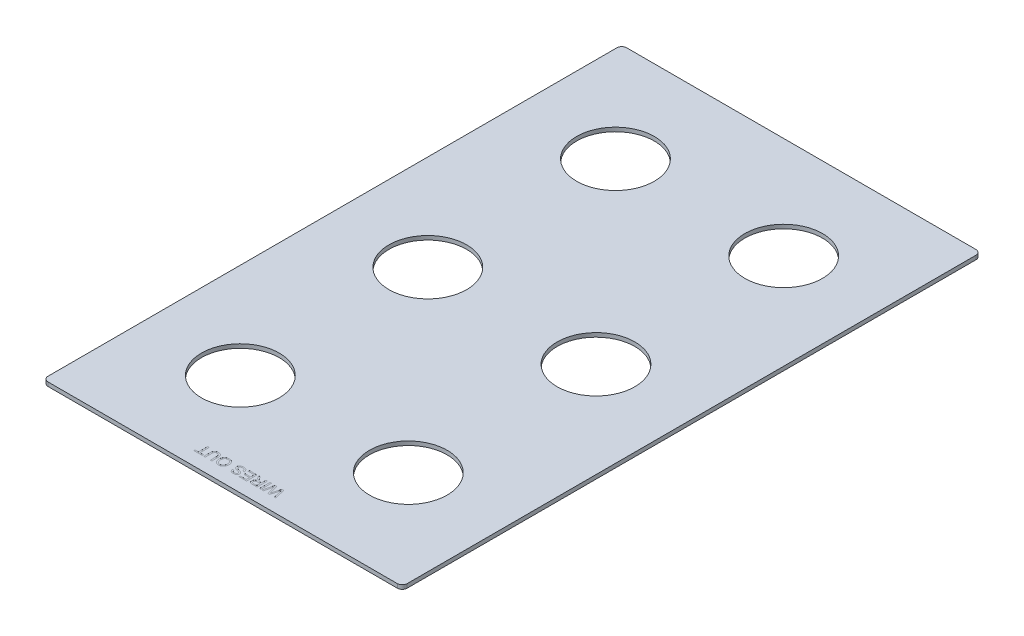
from build123d import *

# Parameters (mm, degrees)
SKETCH1_R           = 24.727
BOSS_EXTRUDE1_DEPTH = 2.54
SKETCH2_W           = 0.941716851
SKETCH2_H           = 6.677628581
CUT_EXTRUDE2_DEPTH  = 0.0254


with BuildPart() as part:
    # Sketch1 → Boss-Extrude1 (new body)
    with BuildSketch(Plane(origin=(0, 0, 0), x_dir=(1, 0, 0), z_dir=(0, 1, 0))):
        with BuildLine():
            Line((-111.125, 184.15), (111.125, 184.15))
            ThreePointArc((111.125, 184.15), (113.37006403, 183.22006403), (114.3, 180.975))
            Line((114.3, 180.975), (114.3, -180.975))
            ThreePointArc((114.3, -180.975), (113.37006403, -183.22006403), (111.125, -184.15))
            Line((111.125, -184.15), (-111.125, -184.15))
            ThreePointArc((-111.125, -184.15), (-113.37006403, -183.22006403), (-114.3, -180.975))
            Line((-114.3, -180.975), (-114.3, 180.975))
            ThreePointArc((-114.3, 180.975), (-113.37006403, 183.22006403), (-111.125, 184.15))
        make_face()
        with Locations((53.5178, -119.508581684)):
            Circle(SKETCH1_R, mode=Mode.SUBTRACT)
        with Locations((53.5178, -0.064290842)):
            Circle(SKETCH1_R, mode=Mode.SUBTRACT)
        with Locations((-53.5178, -119.38)):
            Circle(SKETCH1_R, mode=Mode.SUBTRACT)
        with Locations((-53.5178, -0.064290842)):
            Circle(SKETCH1_R, mode=Mode.SUBTRACT)
        with Locations((-53.5178, 119.38)):
            Circle(SKETCH1_R, mode=Mode.SUBTRACT)
        with Locations((53.5178, 119.38)):
            Circle(SKETCH1_R, mode=Mode.SUBTRACT)
    extrude(amount=BOSS_EXTRUDE1_DEPTH)

    # Sketch2 → Cut-Extrude2 (cut)
    # profile 1 of 8: a face of its own
    with BuildSketch(Plane(origin=(0, 2.54, 0), x_dir=(1, 0, 0), z_dir=(0, 1, 0))):
        with BuildLine():
            Line((23.632943238, -168.91), (25.314389377, -175.587628581))
            Line((25.314389377, -175.587628581), (24.341906208, -175.587628581))
            Line((24.341906208, -175.587628581), (23.350695716, -171.196071163))
            add(Edge.make_bspline(
                [(23.350695716, -171.196071163), (23.299325023, -170.969580808), (23.19710809, -170.518912379), (23.096001693, -170.067993508), (23.045707872, -169.843690855)],
                knots=[0, 0, 0, 0, 1.00513078, 2, 2, 2, 2], degree=3))
            add(Edge.make_bspline(
                [(23.045707872, -169.843690855), (23.021895326, -169.924344538), (22.976941578, -170.076603994), (22.916172822, -170.292446444), (22.860978508, -170.480827734), (22.813955785, -170.642626067), (22.775881668, -170.778068762), (22.743008908, -170.885491505), (22.720603246, -170.966997983), (22.70732561, -171.011932775), (22.701927715, -171.030200581)],
                knots=[0, 0, 0, 0, 1.633809233, 3.084334118, 4.356383392, 5.447555203, 6.357852567, 7.089694452, 7.629924063, 8, 8, 8, 8], degree=3))
            Line((22.701927715, -171.030200581), (21.382989057, -175.587628581))
            Line((21.382989057, -175.587628581), (20.24998597, -175.587628581))
            Line((20.24998597, -175.587628581), (19.296230125, -172.24212596))
            add(Edge.make_bspline(
                [(19.296230125, -172.24212596), (19.243596084, -172.03545393), (19.139813145, -171.627941413), (19.001920759, -171.020936424), (18.874650495, -170.428657498), (18.801340432, -170.036929476), (18.765176731, -169.843690855)],
                knots=[0, 0, 0, 0, 1.04154457, 2.053700482, 3.039894486, 4, 4, 4, 4], degree=3))
            add(Edge.make_bspline(
                [(18.765176731, -169.843690855), (18.742796194, -169.942212876), (18.695517606, -170.150339344), (18.622811501, -170.478808574), (18.540293141, -170.839224554), (18.484149649, -171.09036912), (18.454838223, -171.221486816)],
                knots=[0, 0, 0, 0, 0.858436457, 1.813435672, 2.858437265, 4, 4, 4, 4], degree=3))
            Line((18.454838223, -171.221486816), (17.468978394, -175.587628581))
            Line((17.468978394, -175.587628581), (16.496495226, -175.587628581))
            Line((16.496495226, -175.587628581), (18.179279031, -168.91))
            Line((18.179279031, -168.91), (19.214632501, -168.91))
            Line((19.214632501, -168.91), (20.609818119, -174.01319572))
            add(Edge.make_bspline(
                [(20.609818119, -174.01319572), (20.623827793, -174.063084201), (20.650440955, -174.157853738), (20.685324579, -174.29309308), (20.719917615, -174.412030516), (20.747432964, -174.516203119), (20.771245195, -174.604561153), (20.792331944, -174.676845919), (20.805894374, -174.734472146), (20.815702094, -174.76722518), (20.819831679, -174.781015994)],
                knots=[0, 0, 0, 0, 1.562239628, 2.967673567, 4.210417925, 5.296319877, 6.215971374, 6.969386481, 7.566055473, 8, 8, 8, 8], degree=3))
            add(Edge.make_bspline(
                [(20.819831679, -174.781015994), (20.844657297, -174.693580195), (20.891682413, -174.527957792), (20.960166786, -174.295091919), (21.019046174, -174.090752029), (21.055687775, -173.96458835), (21.072650549, -173.906182442)],
                knots=[0, 0, 0, 0, 1.197732026, 2.268764715, 3.198546125, 4, 4, 4, 4], degree=3))
            Line((21.072650549, -173.906182442), (22.518667475, -168.91))
            Line((22.518667475, -168.91), (23.632943238, -168.91))
        make_face()
    # profile 2 of 8: a face of its own
    with BuildSketch(Plane(origin=(0, 2.54, 0), x_dir=(1, 0, 0), z_dir=(0, 1, 0))):
        with Locations((15.340751818, -172.248814291)):
            Rectangle(SKETCH2_W, SKETCH2_H)
    # profile 3 of 8: a face of its own
    with BuildSketch(Plane(origin=(0, 2.54, 0), x_dir=(1, 0, 0), z_dir=(0, 1, 0))):
        with BuildLine():
            Line((13.328902181, -168.91), (13.328902181, -175.587628581))
            Line((13.328902181, -175.587628581), (10.431517665, -175.587628581))
            add(Edge.make_bspline(
                [(10.431517665, -175.587628581), (10.363292806, -175.587096546), (10.231251578, -175.586066856), (10.03976983, -175.578708935), (9.861463117, -175.563077027), (9.695207674, -175.545618097), (9.541287988, -175.519839646), (9.399630705, -175.489596873), (9.270779114, -175.453853433), (9.153752793, -175.411603204), (9.045169062, -175.363819062), (8.944548789, -175.304828573), (8.847571535, -175.240298913), (8.758103027, -175.163854788), (8.672113635, -175.08172384), (8.593203482, -174.989796624), (8.519037225, -174.890373993), (8.428860855, -174.746400185), (8.334151114, -174.553413553), (8.252576009, -174.308226002), (8.200705014, -174.05148519), (8.195105726, -173.876110271), (8.192264811, -173.787130169)],
                knots=[0, 0, 0, 0, 1.242075696, 2.40389213, 3.487198984, 4.500157661, 5.446319301, 6.326791195, 7.136300648, 7.878370406, 8.590488565, 9.292260633, 9.999224673, 10.708050372, 11.431369221, 12.162165018, 12.910600795, 13.687589445, 15.252257874, 16.810406251, 18.381693487, 20, 20, 20, 20], degree=3))
            add(Edge.make_bspline(
                [(8.192264811, -173.787130169), (8.193571517, -173.730008672), (8.19615235, -173.617189797), (8.215921505, -173.45131567), (8.251692958, -173.292830312), (8.297560289, -173.14034246), (8.360348032, -172.996024572), (8.433051662, -172.856884453), (8.523248176, -172.726910071), (8.623957418, -172.601757556), (8.741064038, -172.487074803), (8.871326311, -172.381080347), (9.018660448, -172.290119283), (9.178234156, -172.205586967), (9.354159906, -172.136163929), (9.54378457, -172.075034695), (9.748575738, -172.02790233), (9.890519546, -172.004161241), (9.963334571, -171.991982422)],
                knots=[0, 0, 0, 0, 0.982645791, 1.940792824, 2.867691729, 3.775150443, 4.675643875, 5.571354211, 6.471357401, 7.392684514, 8.331098131, 9.285922955, 10.275520706, 11.304845665, 12.388884831, 13.524255008, 14.729980297, 16, 16, 16, 16], degree=3))
            add(Edge.make_bspline(
                [(9.963334571, -171.991982422), (9.909404212, -171.965100634), (9.80713011, -171.914121729), (9.667956952, -171.829773388), (9.546035076, -171.750366643), (9.476778417, -171.69082278), (9.44432017, -171.66291659)],
                knots=[0, 0, 0, 0, 1.172551213, 2.223638478, 3.167479604, 4, 4, 4, 4], degree=3))
            add(Edge.make_bspline(
                [(9.44432017, -171.66291659), (9.381132019, -171.601164157), (9.251543527, -171.474520084), (9.074703105, -171.256807636), (8.899721615, -171.017386254), (8.794666383, -170.842915484), (8.740707864, -170.753303723)],
                knots=[0, 0, 0, 0, 0.918170575, 1.883016652, 2.912673989, 4, 4, 4, 4], degree=3))
            Line((8.740707864, -170.753303723), (7.645159425, -168.91))
            Line((7.645159425, -168.91), (8.724655872, -168.91))
            Line((8.724655872, -168.91), (9.556684113, -170.319899945))
            add(Edge.make_bspline(
                [(9.556684113, -170.319899945), (9.586601501, -170.369366751), (9.644576487, -170.465225299), (9.728289267, -170.605242248), (9.810477346, -170.734077121), (9.886334988, -170.85574056), (9.960672974, -170.96702405), (10.027312005, -171.072139162), (10.094234973, -171.165131078), (10.171077393, -171.276850283), (10.264921144, -171.397638948), (10.374430167, -171.52172404), (10.475116427, -171.624510619), (10.602349215, -171.722582681), (10.760556516, -171.812377229), (10.893947832, -171.85497336), (10.958558061, -171.875605481)],
                knots=[0, 0, 0, 0, 1.130591283, 2.190900266, 3.190104209, 4.119071823, 4.994606968, 5.807262858, 6.55236009, 7.234593472, 8.459046683, 9.540234366, 10.471327768, 11.266723835, 12.676093724, 14, 14, 14, 14], degree=3))
            add(Edge.make_bspline(
                [(10.958558061, -171.875605481), (10.985700699, -171.880500221), (11.047668153, -171.891675059), (11.152888735, -171.898973364), (11.28037638, -171.906719538), (11.372768849, -171.90649384), (11.422728157, -171.906371799)],
                knots=[0, 0, 0, 0, 0.709978628, 1.620902492, 2.713552433, 4, 4, 4, 4], degree=3))
            Line((11.422728157, -171.906371799), (12.38718533, -171.906371799))
            Line((12.38718533, -171.906371799), (12.38718533, -168.91))
            Line((12.38718533, -168.91), (13.328902181, -168.91))
        make_face()
        with BuildLine():
            Line((12.38718533, -172.676867405), (10.598725912, -172.676867405))
            add(Edge.make_bspline(
                [(10.598725912, -172.676867405), (10.509041729, -172.678258399), (10.341385561, -172.680858734), (10.10700453, -172.703403287), (9.906514669, -172.738643655), (9.737355011, -172.792167838), (9.595192811, -172.86384728), (9.4719805, -172.951504301), (9.368380463, -173.060253453), (9.28317838, -173.184950494), (9.216573602, -173.320844399), (9.170033561, -173.464671415), (9.138788207, -173.613673587), (9.135593421, -173.715629033), (9.133981662, -173.76706518)],
                knots=[0, 0, 0, 0, 1.546056516, 2.890207646, 4.055830773, 5.050253158, 5.937355789, 6.790906573, 7.644595853, 8.512568064, 9.38593768, 10.244184789, 11.114197691, 12, 12, 12, 12], degree=3))
            add(Edge.make_bspline(
                [(9.133981662, -173.76706518), (9.135218998, -173.804549755), (9.137642576, -173.877971028), (9.150482994, -173.985697904), (9.174913004, -174.087786542), (9.208647521, -174.184972845), (9.251360342, -174.27746782), (9.303847642, -174.364907678), (9.36583859, -174.446845812), (9.436949475, -174.523685608), (9.518568997, -174.593612923), (9.611805656, -174.653942185), (9.715914915, -174.705209834), (9.83102038, -174.745899051), (9.956758704, -174.778443865), (10.093845904, -174.800094864), (10.241654987, -174.815761459), (10.344078112, -174.816667262), (10.396738349, -174.817132975)],
                knots=[0, 0, 0, 0, 0.965235723, 1.89061323, 2.787065514, 3.661873922, 4.534873316, 5.404925039, 6.281839248, 7.175200054, 8.095223355, 9.040740021, 10.02630299, 11.075573487, 12.177989335, 13.364883635, 14.645170704, 16, 16, 16, 16], degree=3))
            Line((10.396738349, -174.817132975), (12.38718533, -174.817132975))
            Line((12.38718533, -174.817132975), (12.38718533, -172.676867405))
        make_face(mode=Mode.SUBTRACT)
    # profile 4 of 8: a face of its own
    with BuildSketch(Plane(origin=(0, 2.54, 0), x_dir=(1, 0, 0), z_dir=(0, 1, 0))):
        Polygon((6.6512736, -168.91), (6.6512736, -175.587628581), (1.942689345, -175.587628581), (1.942689345, -174.817132975), (5.709556749, -174.817132975), (5.709556749, -172.762478027), (2.199521213, -172.762478027), (2.199521213, -171.991982422), (5.709556749, -171.991982422), (5.709556749, -169.680495605), (1.771468099, -169.680495605), (1.771468099, -168.91), align=None)
    # profile 5 of 8: a face of its own
    with BuildSketch(Plane(origin=(0, 2.54, 0), x_dir=(1, 0, 0), z_dir=(0, 1, 0))):
        with BuildLine():
            Line((0.829751248, -171.221486816), (-0.111965603, -171.221486816))
            add(Edge.make_bspline(
                [(-0.111965603, -171.221486816), (-0.122300306, -171.136920767), (-0.142153826, -170.974464831), (-0.198105729, -170.744412505), (-0.268592025, -170.537033889), (-0.361338467, -170.352541821), (-0.475255133, -170.186545829), (-0.617782751, -170.039543528), (-0.788933822, -169.910501137), (-0.984673261, -169.800161916), (-1.198851792, -169.707216884), (-1.429578835, -169.642014332), (-1.673439367, -169.602475454), (-1.840524353, -169.597450703), (-1.925840675, -169.594884983)],
                knots=[0, 0, 0, 0, 1.125761249, 2.162647979, 3.12492346, 4.01623828, 4.884793378, 5.777219259, 6.711258599, 7.709587174, 8.742442187, 9.791331093, 10.872217593, 12, 12, 12, 12], degree=3))
            add(Edge.make_bspline(
                [(-1.925840675, -169.594884983), (-2.00132428, -169.596288662), (-2.148061054, -169.599017353), (-2.361175224, -169.631583172), (-2.561144255, -169.679761442), (-2.745807794, -169.749052862), (-2.911454681, -169.836152826), (-3.058487465, -169.935607161), (-3.180435603, -170.054131077), (-3.279079502, -170.185129954), (-3.35563269, -170.324239119), (-3.409002883, -170.467751543), (-3.444935193, -170.612872597), (-3.448840901, -170.711184835), (-3.450779894, -170.759992053)],
                knots=[0, 0, 0, 0, 1.267544124, 2.464049433, 3.614542348, 4.719673496, 5.768837234, 6.754183997, 7.692231426, 8.612479311, 9.501217876, 10.350240008, 11.180974857, 12, 12, 12, 12], degree=3))
            add(Edge.make_bspline(
                [(-3.450779894, -170.759992053), (-3.448734217, -170.808320403), (-3.444731839, -170.90287513), (-3.41298182, -171.039749764), (-3.361676939, -171.167107787), (-3.289708786, -171.286035669), (-3.191897669, -171.39581424), (-3.065416139, -171.493264907), (-2.913787566, -171.585956174), (-2.799626619, -171.635388546), (-2.739141591, -171.661578924)],
                knots=[0, 0, 0, 0, 0.942081658, 1.843188798, 2.725198023, 3.611401405, 4.541884661, 5.575766242, 6.715586633, 8, 8, 8, 8], degree=3))
            add(Edge.make_bspline(
                [(-2.739141591, -171.661578924), (-2.715616019, -171.671233178), (-2.662467478, -171.693043891), (-2.571372485, -171.721914532), (-2.463281361, -171.75926362), (-2.335982467, -171.797529049), (-2.189343903, -171.83852873), (-2.02471077, -171.885712807), (-1.840776969, -171.934847595), (-1.643984004, -171.986863987), (-1.444785638, -172.039623623), (-1.254502177, -172.093569336), (-1.078352587, -172.144734389), (-0.917007378, -172.197320494), (-0.770312038, -172.249221233), (-0.637865794, -172.300101227), (-0.519433039, -172.34869434), (-0.447100591, -172.384431007), (-0.412940449, -172.401308212)],
                knots=[0, 0, 0, 0, 0.499208779, 1.12780332, 1.87546358, 2.745246929, 3.737578632, 4.865834649, 6.108484299, 7.476352792, 8.863398792, 10.155242256, 11.360521946, 12.465428895, 13.487415091, 14.415997097, 15.251929613, 16, 16, 16, 16], degree=3))
            add(Edge.make_bspline(
                [(-0.412940449, -172.401308212), (-0.33439709, -172.443817677), (-0.182787966, -172.525872006), (0.022051427, -172.671714273), (0.19175084, -172.836704186), (0.331696087, -173.014473096), (0.439742994, -173.205942272), (0.516080243, -173.409014609), (0.565656107, -173.622897826), (0.570471317, -173.769909024), (0.572919379, -173.844649807)],
                knots=[0, 0, 0, 0, 1.158956011, 2.237086722, 3.252429106, 4.221720014, 5.165272549, 6.094237939, 7.031106807, 8, 8, 8, 8], degree=3))
            add(Edge.make_bspline(
                [(0.572919379, -173.844649807), (0.5697455, -173.927437968), (0.563432677, -174.092103021), (0.507294577, -174.333691375), (0.417883054, -174.56692136), (0.314888491, -174.751512006), (0.215916434, -174.891668806), (0.132735448, -174.991049213), (0.04094839, -175.083472006), (-0.057437483, -175.170854779), (-0.165974497, -175.249930177), (-0.281411584, -175.323343203), (-0.406113443, -175.38912905), (-0.582665272, -175.469334226), (-0.817493636, -175.551565656), (-1.113162554, -175.622810202), (-1.424366052, -175.664515975), (-1.636779572, -175.670290332), (-1.745255767, -175.673239204)],
                knots=[0, 0, 0, 0, 1.200056028, 2.386902731, 3.579012093, 4.815906327, 5.442508847, 6.067203999, 6.694073756, 7.331409728, 7.974631341, 8.640655778, 9.315145047, 10.018831381, 11.453504181, 12.917815188, 14.425977399, 16, 16, 16, 16], degree=3))
            add(Edge.make_bspline(
                [(-1.745255767, -175.673239204), (-1.864008344, -175.670604036), (-2.094800286, -175.665482671), (-2.430387838, -175.620316752), (-2.744325301, -175.547538362), (-2.990076794, -175.461794803), (-3.172239093, -175.376566745), (-3.300639933, -175.307887436), (-3.420230957, -175.230485202), (-3.533294276, -175.14853061), (-3.635789241, -175.056685259), (-3.731948999, -174.959779443), (-3.820155827, -174.855945122), (-3.924903958, -174.707643741), (-4.03554884, -174.509311317), (-4.135470952, -174.254928517), (-4.199457348, -173.984452318), (-4.213925457, -173.798607284), (-4.221275499, -173.704194878)],
                knots=[0, 0, 0, 0, 1.607451709, 3.124032445, 4.575401297, 5.965664223, 6.638286369, 7.297495781, 7.935629741, 8.566004073, 9.186263309, 9.796807256, 10.413736732, 11.028594479, 12.253110936, 13.478624344, 14.719098735, 16, 16, 16, 16], degree=3))
            Line((-4.221275499, -173.704194878), (-3.279558648, -173.704194878))
            add(Edge.make_bspline(
                [(-3.279558648, -173.704194878), (-3.273771602, -173.752058718), (-3.262436422, -173.845810392), (-3.230636994, -173.980547909), (-3.192600267, -174.10710359), (-3.144232188, -174.224055068), (-3.086506247, -174.332436506), (-3.018033712, -174.431011758), (-2.94152464, -174.521646465), (-2.85513315, -174.602750037), (-2.758041884, -174.673975704), (-2.650230509, -174.735532482), (-2.532098757, -174.788145122), (-2.402500751, -174.828705316), (-2.26316937, -174.862387332), (-2.112501629, -174.886565121), (-1.951024251, -174.899089809), (-1.839803256, -174.901504216), (-1.782710414, -174.902743598)],
                knots=[0, 0, 0, 0, 1.074256797, 2.104164074, 3.082231143, 4.018364317, 4.921387537, 5.814946689, 6.689553043, 7.561782592, 8.450683137, 9.368204304, 10.325224224, 11.328240899, 12.391723181, 13.519579538, 14.726730929, 16, 16, 16, 16], degree=3))
            add(Edge.make_bspline(
                [(-1.782710414, -174.902743598), (-1.723364228, -174.902302171), (-1.608484606, -174.901447678), (-1.442447663, -174.885584388), (-1.288428272, -174.864200282), (-1.147375889, -174.8313749), (-1.017974289, -174.79275508), (-0.902493225, -174.740895859), (-0.798180298, -174.682436669), (-0.706937899, -174.61391263), (-0.62829401, -174.537943815), (-0.557710091, -174.459906863), (-0.500797494, -174.375719234), (-0.450683023, -174.290042614), (-0.415765366, -174.198320253), (-0.388355797, -174.104542703), (-0.371689275, -174.006649151), (-0.369774726, -173.940134121), (-0.368797472, -173.906182442)],
                knots=[0, 0, 0, 0, 1.464224776, 2.834379057, 4.11387117, 5.299348816, 6.406355048, 7.441191667, 8.417293255, 9.352838038, 10.248153785, 11.113750317, 11.944205591, 12.75240885, 13.557683963, 14.358962649, 15.162355132, 16, 16, 16, 16], degree=3))
            add(Edge.make_bspline(
                [(-0.368797472, -173.906182442), (-0.37123109, -173.848731061), (-0.375954518, -173.737223227), (-0.424187626, -173.578804208), (-0.498370483, -173.434395009), (-0.571452417, -173.3558227), (-0.608239683, -173.316271744)],
                knots=[0, 0, 0, 0, 1.050964922, 2.039826012, 3.013306874, 4, 4, 4, 4], degree=3))
            add(Edge.make_bspline(
                [(-0.608239683, -173.316271744), (-0.631429982, -173.296506065), (-0.682713897, -173.252795485), (-0.778135549, -173.194949737), (-0.89644413, -173.136503535), (-1.038430802, -173.078405591), (-1.203848303, -173.019938836), (-1.392443217, -172.959783733), (-1.605290389, -172.899729949), (-1.835341443, -172.842797028), (-2.06742145, -172.784340103), (-2.287668031, -172.726739864), (-2.490671798, -172.672911415), (-2.674095348, -172.616871264), (-2.840956873, -172.567716205), (-2.987948727, -172.515816054), (-3.11771171, -172.468717275), (-3.19717772, -172.435472738), (-3.234078005, -172.420035536)],
                knots=[0, 0, 0, 0, 0.523895407, 1.158562347, 1.913798076, 2.79478753, 3.797549825, 4.933675542, 6.202127117, 7.604032848, 9.013379355, 10.32225155, 11.523321485, 12.628397413, 13.623935419, 14.51727859, 15.311493772, 16, 16, 16, 16], degree=3))
            add(Edge.make_bspline(
                [(-3.234078005, -172.420035536), (-3.282099123, -172.397911246), (-3.376356532, -172.354484974), (-3.509729216, -172.280126565), (-3.634989015, -172.203572345), (-3.748235425, -172.119213657), (-3.855033152, -172.034742137), (-3.949935026, -171.943421237), (-4.03498244, -171.847399774), (-4.135724875, -171.715469781), (-4.239063497, -171.53739795), (-4.32785, -171.307252493), (-4.383388253, -171.061361326), (-4.389423008, -170.891824444), (-4.392496745, -170.805472696)],
                knots=[0, 0, 0, 0, 0.899363591, 1.76530001, 2.59691609, 3.395188894, 4.166615117, 4.912545108, 5.632755751, 6.347510175, 7.734752518, 9.118421309, 10.532299558, 12, 12, 12, 12], degree=3))
            add(Edge.make_bspline(
                [(-4.392496745, -170.805472696), (-4.38895673, -170.718216064), (-4.381910949, -170.544547011), (-4.323029718, -170.288939319), (-4.228552762, -170.041766988), (-4.119204846, -169.845674821), (-4.015428246, -169.695673965), (-3.928279472, -169.587851279), (-3.831628839, -169.488155207), (-3.727864782, -169.393458837), (-3.616178846, -169.30569683), (-3.495631673, -169.224832572), (-3.367489359, -169.150049501), (-3.184530779, -169.058819838), (-2.941241491, -168.964081688), (-2.632292045, -168.881909663), (-2.305506818, -168.833218795), (-2.081621479, -168.827373774), (-1.96730832, -168.824389377)],
                knots=[0, 0, 0, 0, 1.196987384, 2.382393894, 3.582009067, 4.820735309, 5.454243406, 6.085350439, 6.72189866, 7.359035515, 8.013098289, 8.67027723, 9.350744424, 10.048966745, 11.475869723, 12.9268444, 14.430883741, 16, 16, 16, 16], degree=3))
            add(Edge.make_bspline(
                [(-1.96730832, -168.824389377), (-1.894611976, -168.825066361), (-1.751765216, -168.82639662), (-1.542326645, -168.839585244), (-1.342192809, -168.863413354), (-1.150563024, -168.89099369), (-0.968341294, -168.932446252), (-0.794482035, -168.979218191), (-0.63057113, -169.037895171), (-0.474803619, -169.102452696), (-0.328605544, -169.178733963), (-0.188907253, -169.260489596), (-0.059089327, -169.354273292), (0.064694543, -169.453730246), (0.178709516, -169.564374285), (0.284274783, -169.683623433), (0.382537737, -169.811206702), (0.471756298, -169.94726202), (0.551403598, -170.090229329), (0.623106063, -170.237623704), (0.683111758, -170.390231372), (0.732561435, -170.547693563), (0.773039531, -170.709295471), (0.801901647, -170.876113556), (0.822853734, -171.04710129), (0.827438496, -171.163014962), (0.829751248, -171.221486816)],
                knots=[0, 0, 0, 0, 1.259929758, 2.475735005, 3.634725603, 4.752877801, 5.82919746, 6.871690464, 7.871395985, 8.84458164, 9.791640072, 10.727373556, 11.647336026, 12.564665335, 13.477425593, 14.397128332, 15.323044476, 16.266184727, 17.214251675, 18.157898412, 19.105082968, 20.053433368, 21.01687335, 21.990151059, 22.98614553, 24, 24, 24, 24], degree=3))
        make_face()
    # profile 6 of 8: a face of its own
    with BuildSketch(Plane(origin=(0, 2.54, 0), x_dir=(1, 0, 0), z_dir=(0, 1, 0))):
        with BuildLine():
            add(Edge.make_bspline(
                [(-7.902532281, -172.160528336), (-7.904868823, -172.294404113), (-7.909421457, -172.555254276), (-7.95145786, -172.935167661), (-8.020805874, -173.292189836), (-8.116201245, -173.627972316), (-8.243080235, -173.939982669), (-8.393628601, -174.232057602), (-8.576292795, -174.499113512), (-8.782691478, -174.744238191), (-9.013292565, -174.960926501), (-9.258801186, -175.153382006), (-9.5223022, -175.313911345), (-9.801356042, -175.446456), (-10.097149626, -175.54821986), (-10.408852094, -175.619463844), (-10.73613018, -175.665423132), (-10.959832408, -175.670596003), (-11.074138323, -175.673239204)],
                knots=[0, 0, 0, 0, 1.203593535, 2.345140965, 3.431924157, 4.471254512, 5.478692091, 6.45615896, 7.42038538, 8.382007041, 9.33218277, 10.260966195, 11.182476517, 12.100814648, 13.034113903, 13.98924309, 14.972556454, 16, 16, 16, 16], degree=3))
            add(Edge.make_bspline(
                [(-11.074138323, -175.673239204), (-11.149533304, -175.671934631), (-11.2992541, -175.669343985), (-11.521000104, -175.649238618), (-11.736781479, -175.614330091), (-11.946724691, -175.565766742), (-12.151139417, -175.504669011), (-12.349890712, -175.429209665), (-12.543296166, -175.340933857), (-12.72962409, -175.238335871), (-12.907551192, -175.122886619), (-13.076351255, -174.997786024), (-13.233401839, -174.860524933), (-13.379460856, -174.712925043), (-13.515657342, -174.555062251), (-13.637638745, -174.383988246), (-13.752624989, -174.205105922), (-13.853438417, -174.014308827), (-13.944828148, -173.81598128), (-14.021432258, -173.609263699), (-14.089271715, -173.397118639), (-14.144048276, -173.178228466), (-14.184879158, -172.951968662), (-14.216276445, -172.719965089), (-14.233230262, -172.480928323), (-14.236209714, -172.319734193), (-14.23771837, -172.238112963)],
                knots=[0, 0, 0, 0, 1.034176269, 2.053687022, 3.051235935, 4.030520976, 5.007759882, 5.975670013, 6.944584641, 7.921900115, 8.890679583, 9.85222947, 10.801660264, 11.7488817, 12.698942795, 13.658174729, 14.62880618, 15.613957309, 16.61577279, 17.622338666, 18.636016077, 19.670029534, 20.714984856, 21.788550191, 22.880224384, 24, 24, 24, 24], degree=3))
            add(Edge.make_bspline(
                [(-14.23771837, -172.238112963), (-14.23632704, -172.155147409), (-14.233578228, -171.991234652), (-14.214978638, -171.749085358), (-14.182274095, -171.513887669), (-14.138897087, -171.284940267), (-14.08077322, -171.062719774), (-14.011701935, -170.846589067), (-13.928156318, -170.637835469), (-13.833800806, -170.435955826), (-13.727037631, -170.243726737), (-13.609270434, -170.062492165), (-13.480416558, -169.893948118), (-13.342430464, -169.736024416), (-13.192553381, -169.591989944), (-13.031942973, -169.459700845), (-12.860927681, -169.339726304), (-12.680177856, -169.23135865), (-12.492581258, -169.136071154), (-12.300415691, -169.051863457), (-12.103454523, -168.983732216), (-11.904579332, -168.923302758), (-11.700828725, -168.879850893), (-11.494123972, -168.847472249), (-11.283166388, -168.828538825), (-11.141503927, -168.825779634), (-11.070125326, -168.824389377)],
                knots=[0, 0, 0, 0, 1.141458971, 2.255149016, 3.338763392, 4.407145747, 5.45911027, 6.497028761, 7.526847988, 8.550472592, 9.561035647, 10.549629976, 11.521388012, 12.477647518, 13.432134385, 14.377847498, 15.337760086, 16.303574593, 17.274809663, 18.230970776, 19.187525402, 20.140611526, 21.088808525, 22.051011914, 23.017975238, 24, 24, 24, 24], degree=3))
            add(Edge.make_bspline(
                [(-11.070125326, -168.824389377), (-10.993387527, -168.825578265), (-10.841389166, -168.827933154), (-10.616494071, -168.849614076), (-10.397937614, -168.88672926), (-10.184469546, -168.93331902), (-9.978465382, -168.998729636), (-9.778201489, -169.075799462), (-9.585162533, -169.169065442), (-9.398356806, -169.274423347), (-9.219457707, -169.39122805), (-9.052258186, -169.52060398), (-8.894291212, -169.6580082), (-8.750367804, -169.808767929), (-8.616177575, -169.968166885), (-8.492171182, -170.137588378), (-8.380100815, -170.317881087), (-8.280587519, -170.508080587), (-8.190852932, -170.703360022), (-8.115208666, -170.90361748), (-8.048743226, -171.105945631), (-7.995807462, -171.311579843), (-7.953624841, -171.520048878), (-7.92525991, -171.731005018), (-7.90477459, -171.944762669), (-7.903283479, -172.088244511), (-7.902532281, -172.160528336)],
                knots=[0, 0, 0, 0, 1.072846099, 2.125039441, 3.155166917, 4.171599398, 5.177324298, 6.174217088, 7.169783185, 8.172042761, 9.17156421, 10.154239632, 11.126115549, 12.096189878, 13.065322046, 14.038037562, 15.029377678, 16.03062832, 17.03785952, 18.032507603, 19.022297599, 20.014323703, 20.999862951, 21.994471951, 22.989647507, 24, 24, 24, 24], degree=3))
        make_face()
        with BuildLine():
            add(Edge.make_bspline(
                [(-8.844249132, -172.149827008), (-8.845691451, -172.053420401), (-8.848503871, -171.865434323), (-8.880709052, -171.591367712), (-8.929517803, -171.332745434), (-8.996992393, -171.088962695), (-9.0870792, -170.861811602), (-9.197220938, -170.650855955), (-9.32641992, -170.455098662), (-9.474608164, -170.276758173), (-9.637434381, -170.116495336), (-9.811433573, -169.976453044), (-9.996444093, -169.859676631), (-10.190016428, -169.762138022), (-10.394717097, -169.686984881), (-10.609565389, -169.633858343), (-10.83455709, -169.60069725), (-10.98796563, -169.596846543), (-11.066112328, -169.594884983)],
                knots=[0, 0, 0, 0, 1.215616022, 2.370365452, 3.475740397, 4.533490648, 5.5560781, 6.552384115, 7.530550651, 8.509299237, 9.471863928, 10.40830403, 11.321168121, 12.226759389, 13.137923578, 14.065605683, 15.014614662, 16, 16, 16, 16], degree=3))
            add(Edge.make_bspline(
                [(-11.066112328, -169.594884983), (-11.145584318, -169.59687414), (-11.301190252, -169.600768903), (-11.529564036, -169.633370577), (-11.746544715, -169.688873529), (-11.954282865, -169.762760558), (-12.149023112, -169.862643127), (-12.335318626, -169.979605429), (-12.508095682, -170.122528616), (-12.671577088, -170.283079607), (-12.818263713, -170.465554814), (-12.948207868, -170.665555052), (-13.054493607, -170.8855657), (-13.143154965, -171.12242268), (-13.21270247, -171.377612405), (-13.261322688, -171.651132636), (-13.291306379, -171.942262372), (-13.294408799, -172.142171822), (-13.296001519, -172.244801292)],
                knots=[0, 0, 0, 0, 0.976909331, 1.912785716, 2.828990727, 3.727421029, 4.617481149, 5.514840137, 6.426786422, 7.368873452, 8.327895072, 9.299698503, 10.295216142, 11.325792517, 12.405818789, 13.542541501, 14.738390493, 16, 16, 16, 16], degree=3))
            add(Edge.make_bspline(
                [(-13.296001519, -172.244801292), (-13.295432936, -172.310823356), (-13.294317582, -172.440334751), (-13.279546538, -172.631236025), (-13.260493814, -172.816199196), (-13.231485645, -172.994985502), (-13.191509057, -173.166854888), (-13.147220595, -173.333114569), (-13.091843858, -173.492336242), (-13.028995551, -173.645128244), (-12.958725969, -173.790764274), (-12.879266751, -173.927807016), (-12.79230587, -174.056711184), (-12.69694247, -174.17690135), (-12.595587364, -174.290074697), (-12.48501404, -174.393289023), (-12.367044024, -174.488597735), (-12.241662552, -174.575025805), (-12.110881776, -174.652718043), (-11.975365427, -174.719721399), (-11.835545168, -174.776527398), (-11.691564755, -174.821039592), (-11.544290507, -174.857788881), (-11.393367263, -174.885010337), (-11.237612443, -174.899281733), (-11.132575308, -174.901581356), (-11.079488987, -174.902743598)],
                knots=[0, 0, 0, 0, 1.220320263, 2.393826742, 3.538159925, 4.657606474, 5.739544833, 6.799495376, 7.837090465, 8.853610905, 9.852768056, 10.824163015, 11.779900663, 12.724912201, 13.658747054, 14.586045767, 15.518168864, 16.460299482, 17.399069918, 18.328125852, 19.252745725, 20.186143833, 21.111865538, 22.057883325, 23.018444021, 24, 24, 24, 24], degree=3))
            add(Edge.make_bspline(
                [(-11.079488987, -174.902743598), (-11.004461348, -174.901228359), (-10.855981652, -174.8982297), (-10.63802316, -174.865825669), (-10.427655857, -174.817041995), (-10.226347354, -174.746576448), (-10.031803252, -174.658111997), (-9.846262357, -174.547970392), (-9.668543877, -174.418461794), (-9.499403075, -174.270137272), (-9.341758209, -174.09901986), (-9.208411133, -173.897407891), (-9.096043603, -173.669968126), (-9.002212749, -173.417318896), (-8.930671151, -173.137491444), (-8.881226496, -172.831693578), (-8.850008279, -172.499601999), (-8.846217925, -172.269399341), (-8.844249132, -172.149827008)],
                knots=[0, 0, 0, 0, 0.895098135, 1.771399171, 2.624879489, 3.470001555, 4.31324378, 5.172350046, 6.041214072, 6.935108351, 7.854676913, 8.809932058, 9.809814619, 10.877726151, 12.02168834, 13.252153056, 14.572707754, 16, 16, 16, 16], degree=3))
        make_face(mode=Mode.SUBTRACT)
    # profile 7 of 8: a face of its own
    with BuildSketch(Plane(origin=(0, 2.54, 0), x_dir=(1, 0, 0), z_dir=(0, 1, 0))):
        with BuildLine():
            Line((-19.631187609, -175.587628581), (-20.57290446, -175.587628581))
            Line((-20.57290446, -175.587628581), (-20.57290446, -171.745851881))
            add(Edge.make_bspline(
                [(-20.57290446, -171.745851881), (-20.57192501, -171.664247803), (-20.570019001, -171.505446134), (-20.561299934, -171.273844826), (-20.54415202, -171.055138552), (-20.518473348, -170.850000395), (-20.487784822, -170.657160187), (-20.451529682, -170.477269216), (-20.405329106, -170.31048789), (-20.353471363, -170.154985437), (-20.291719256, -170.009391707), (-20.218696545, -169.871618347), (-20.134771499, -169.740800183), (-20.038997968, -169.617225143), (-19.932898092, -169.500142704), (-19.815223272, -169.390478973), (-19.68544541, -169.288992677), (-19.546855025, -169.191847255), (-19.395802439, -169.104969249), (-19.232620143, -169.030031887), (-19.058355179, -168.965574542), (-18.872159021, -168.913754817), (-18.674886182, -168.87415287), (-18.46682239, -168.844540645), (-18.247453126, -168.827036747), (-18.097362537, -168.825284902), (-18.020637767, -168.824389377)],
                knots=[0, 0, 0, 0, 1.311377147, 2.551942077, 3.723550895, 4.835332178, 5.873100029, 6.860965504, 7.782222652, 8.65229484, 9.493385443, 10.320318369, 11.155067733, 11.987723446, 12.829729107, 13.691560723, 14.568860379, 15.475173283, 16.409214366, 17.364531151, 18.357450607, 19.391849073, 20.466818896, 21.588529868, 22.767281177, 24, 24, 24, 24], degree=3))
            add(Edge.make_bspline(
                [(-18.020637767, -168.824389377), (-17.945707184, -168.825492015), (-17.799710789, -168.827640419), (-17.585767701, -168.842176993), (-17.382254078, -168.867912541), (-17.188586558, -168.901766855), (-17.005718965, -168.947263096), (-16.833869804, -169.003868508), (-16.671919216, -169.069157223), (-16.519670433, -169.143700079), (-16.379396063, -169.230427823), (-16.24748194, -169.323051281), (-16.127830338, -169.427424286), (-16.018137536, -169.539614763), (-15.918239724, -169.660544816), (-15.83009427, -169.79136773), (-15.750285309, -169.930207297), (-15.684045049, -170.080651617), (-15.62424082, -170.24122443), (-15.574119498, -170.415302144), (-15.531322211, -170.602884958), (-15.497280422, -170.804405986), (-15.468391974, -171.019786753), (-15.4511903, -171.24981222), (-15.438263826, -171.493332251), (-15.436944188, -171.660221793), (-15.43626709, -171.745851881)],
                knots=[0, 0, 0, 0, 1.193078897, 2.324621146, 3.412165798, 4.458033356, 5.453301711, 6.409727336, 7.336550967, 8.231923267, 9.10494906, 9.959977801, 10.795507141, 11.62892236, 12.456145611, 13.289107106, 14.138012467, 15.002334476, 15.903094886, 16.864671381, 17.884255983, 18.965082669, 20.117808422, 21.342986352, 22.636701193, 24, 24, 24, 24], degree=3))
            Line((-15.43626709, -171.745851881), (-15.43626709, -175.587628581))
            Line((-15.43626709, -175.587628581), (-16.377983941, -175.587628581))
            Line((-16.377983941, -175.587628581), (-16.377983941, -171.789994859))
            add(Edge.make_bspline(
                [(-16.377983941, -171.789994859), (-16.378599989, -171.720878857), (-16.379788662, -171.587518513), (-16.385973544, -171.394329382), (-16.398394308, -171.215057108), (-16.413559277, -171.049840836), (-16.434880425, -170.898922017), (-16.461682215, -170.762391193), (-16.491970659, -170.639457766), (-16.537132914, -170.495572257), (-16.613199955, -170.335582907), (-16.728413961, -170.16286909), (-16.876113894, -170.017836074), (-17.047245029, -169.894823308), (-17.242803501, -169.798882357), (-17.459346341, -169.729045107), (-17.69665151, -169.687224186), (-17.861727698, -169.682788629), (-17.947066138, -169.680495605)],
                knots=[0, 0, 0, 0, 1.090438201, 2.104016592, 3.048763244, 3.925116223, 4.720979001, 5.45216101, 6.119252661, 6.717681473, 7.82855347, 8.901677854, 9.976092604, 11.075141713, 12.213970494, 13.397440122, 14.654570346, 16, 16, 16, 16], degree=3))
            add(Edge.make_bspline(
                [(-17.947066138, -169.680495605), (-18.020230425, -169.681739968), (-18.161503258, -169.684142707), (-18.365209886, -169.703554154), (-18.551977222, -169.738859127), (-18.723679921, -169.784712746), (-18.87893292, -169.846197227), (-19.018851259, -169.92065566), (-19.139734436, -170.012153114), (-19.249111741, -170.114862262), (-19.341476202, -170.2398953), (-19.418659774, -170.388483569), (-19.485224023, -170.560749715), (-19.53973443, -170.75833113), (-19.579542333, -170.981466532), (-19.610641149, -171.228761079), (-19.626952591, -171.501288824), (-19.629735298, -171.690989177), (-19.631187609, -171.789994859)],
                knots=[0, 0, 0, 0, 1.111591514, 2.146370713, 3.104407205, 3.996889121, 4.842307775, 5.6365848, 6.396727704, 7.139400744, 7.909024799, 8.745519786, 9.676513234, 10.710427131, 11.854494362, 13.117490512, 14.495602074, 16, 16, 16, 16], degree=3))
            Line((-19.631187609, -171.789994859), (-19.631187609, -175.587628581))
        make_face()
    # profile 8 of 8: a face of its own
    with BuildSketch(Plane(origin=(0, 2.54, 0), x_dir=(1, 0, 0), z_dir=(0, 1, 0))):
        Polygon((-23.740497504, -168.91), (-23.740497504, -174.817132975), (-21.600231934, -174.817132975), (-21.600231934, -175.587628581), (-26.822479926, -175.587628581), (-26.822479926, -174.817132975), (-24.682214355, -174.817132975), (-24.682214355, -168.91), align=None)
    extrude(amount=-CUT_EXTRUDE2_DEPTH, mode=Mode.SUBTRACT)


solid = part.part
